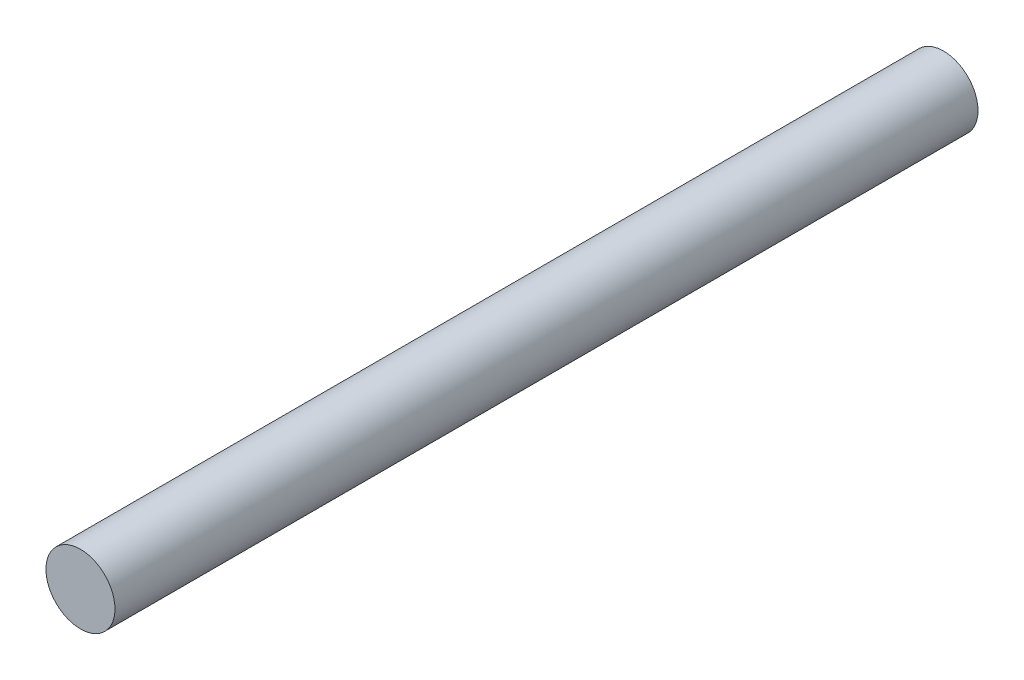
from build123d import *

# Parameters (mm, degrees)
IZIM1_R                     = 10
Y_KSEKLIK_EKSTR_ZYON1_DEPTH = 250


with BuildPart() as part:
    # Çizim1 → Yükseklik-Ekstrüzyon1 (new body)
    with BuildSketch(Plane.XY):
        Circle(IZIM1_R)
    extrude(amount=Y_KSEKLIK_EKSTR_ZYON1_DEPTH)


solid = part.part
